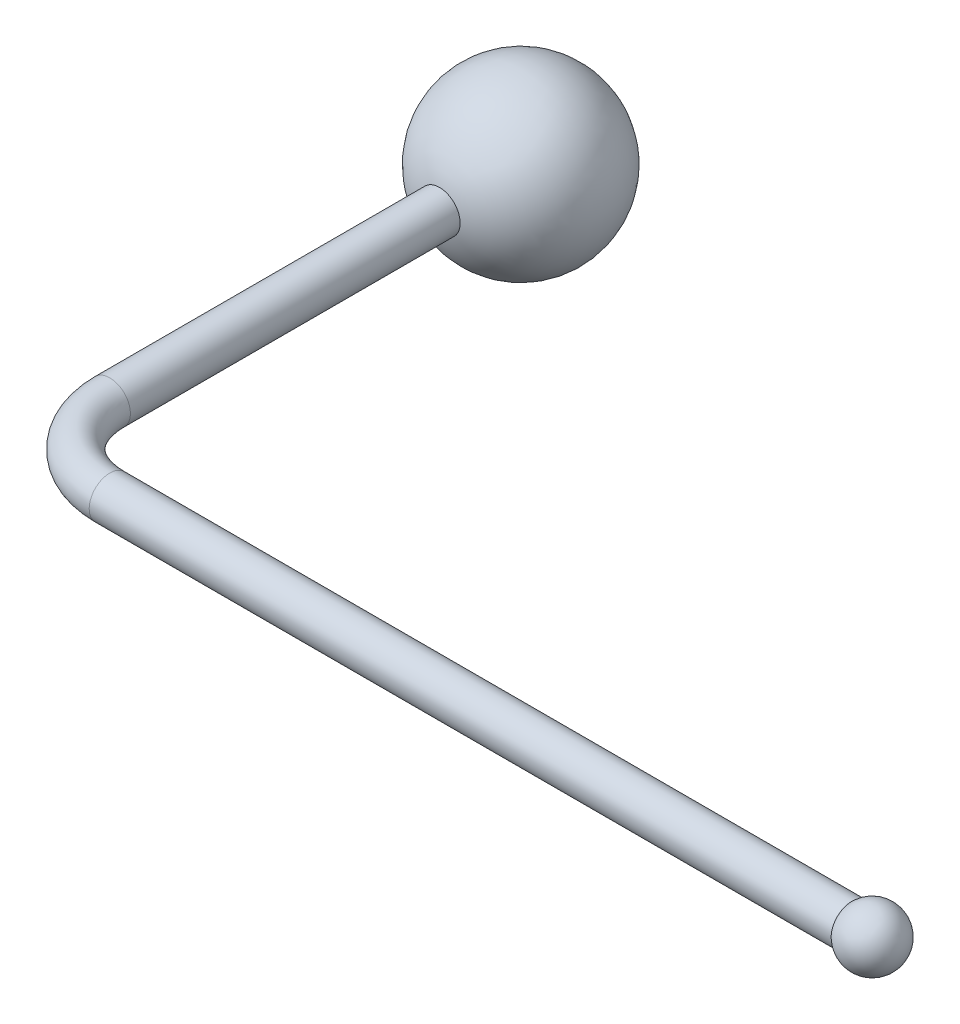
from build123d import *

# Parameters (mm, degrees)
SKETCH2_R         = 2.5
DOME1_FACE_RADIUS = 2.5
DOME1_HEIGHT      = 6


# Read off the part's stored shape, not the designer's step: Dome2
with BuildPart() as part:
    # Sweep1: sweep along a curve in space
    with BuildLine() as sweep1_path:
        Line((0, 0, 0), (0, 0, 40))
        ThreePointArc((10, 0, 50), (2.928932188, 0, 47.071067812), (0, 0, 40))
        Line((10, 0, 50), (100, 0, 50))
    # Sketch2 → Sweep1 (sweep)
    with BuildSketch(Plane.XY):
        Circle(SKETCH2_R)
    sweep(path=sweep1_path.line)

    # Dome1: a dome of height H over a round flat face of radius A is a cap of a sphere of radius (A * A + H * H) / (2 * H)
    dome1_r = (DOME1_FACE_RADIUS * DOME1_FACE_RADIUS + DOME1_HEIGHT * DOME1_HEIGHT) / (2 * DOME1_HEIGHT)
    dome1_base = Plane((100, 0, 50), z_dir=(1, 0, 0))
    with Locations(dome1_base.offset(DOME1_HEIGHT - dome1_r)):
        dome1_ball = Sphere(dome1_r, mode=Mode.PRIVATE)
    add(split(dome1_ball, bisect_by=dome1_base, keep=Keep.TOP, mode=Mode.PRIVATE))

    # Dome2 outline → Dome2 (revolve)
    with BuildSketch(Plane.XZ):
        with BuildLine():
            Line((0, 3e-09), (0, -20))
            ThreePointArc((0, -20), (10.077822186, -11.10347777), (2.499999995, 2e-09))
            Line((2.499999995, 2e-09), (0, 3e-09))
        make_face()
    revolve(axis=Axis((0, 0, 0), (0, 0, 1)))


solid = part.part
